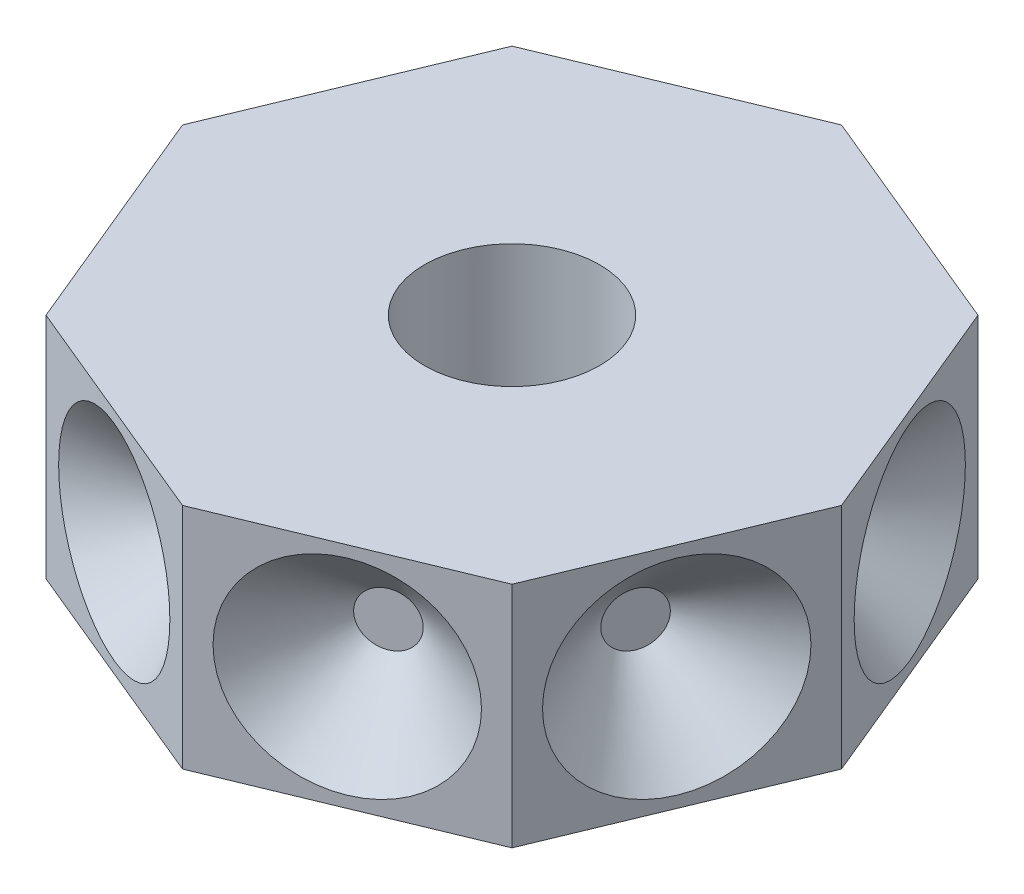
from build123d import *

# Parameters (mm, degrees)
BOSS_EXTRUDE1_DEPTH = 3
SKETCH2_R           = 1.15
CUT_EXTRUDE1_DEPTH  = 3
SKETCH3_R           = 0.15
CUT_EXTRUDE2_DEPTH  = 1
CHAMFER1_SIZE       = 1.2
CIRPATTERN3_COUNT   = 8
CHAMFER2_SIZE       = 1.2


with BuildPart() as part:
    # Sketch1 → Boss-Extrude1 (new body)
    with BuildSketch(Plane(origin=(0, 0, 0), x_dir=(1, 0, 0), z_dir=(0, 1, 0))):
        Polygon((4.329568801, 0), (3.061467459, 3.061467459), (0, 4.329568801), (-3.061467459, 3.061467459), (-4.329568801, 0), (-3.061467459, -3.061467459), (0, -4.329568801), (3.061467459, -3.061467459), align=None)
    extrude(amount=BOSS_EXTRUDE1_DEPTH)

    # Sketch2 → Cut-Extrude1 (cut)
    with BuildSketch(Plane.XZ):
        with Locations(Location((0, 0, 0), (0, 0, 270))):
            Circle(SKETCH2_R)
    extrude(amount=-CUT_EXTRUDE1_DEPTH, mode=Mode.SUBTRACT)

    # Sketch3 → Cut-Extrude2 (cut)
    with BuildSketch(Plane(origin=(-1.530733729, 0, 3.69551813), x_dir=(0.9238795325112894, 0, 0.3826834323650832), z_dir=(-0.3826834323650833, 0, 0.9238795325112895))):
        with Locations((0, 1.5)):
            Circle(SKETCH3_R)
    cut_extrude2 = extrude(amount=-CUT_EXTRUDE2_DEPTH, mode=Mode.SUBTRACT)

    # Chamfer1
    # the kernel refuses this chamfer: 1.2 mm, written as the material it takes off along each edge
    with BuildSketch(Plane(origin=(-1.530733729, 1.5, 3.69551813), x_dir=(0.9238795325112892, 0, 0.382683432365084), z_dir=(0, -1, 0))) as chamfer1_piece_1_section:
        Polygon((0.15 + CHAMFER1_SIZE, 0), (0.15, -CHAMFER1_SIZE), (0.15, 0), align=None)
    chamfer1_piece_1 = revolve(axis=Axis((-1.530733729, 1.5, 3.69551813), (-0.3826834323650833, 0, 0.9238795325112895)), mode=Mode.PRIVATE)
    chamfer1_piece_1 = split(chamfer1_piece_1, bisect_by=Plane(origin=(-1.939951072, 1.5, 2.443622557), z_dir=(-0.3826834323650833, 0, 0.9238795325112895)), keep=Keep.TOP, mode=Mode.PRIVATE)
    add(chamfer1_piece_1, mode=Mode.SUBTRACT)

    # CirPattern3: Cut-Extrude2 ×8 about axis
    cirpattern3_axis = Axis((0, 0, 0), (0, 1, 0))
    for i in range(1, CIRPATTERN3_COUNT):
        add(cut_extrude2.rotate(cirpattern3_axis, i * 360 / CIRPATTERN3_COUNT), mode=Mode.SUBTRACT)

    # Chamfer2
    # the kernel refuses this chamfer: 1.2 mm, written as the material it takes off along each edge
    with BuildSketch(Plane(origin=(1.530733729, 1.5, 3.69551813), x_dir=(0.9238795325112833, 0, -0.3826834323650982), z_dir=(0, -1, 0))) as chamfer2_piece_1_section:
        Polygon((0.15 + CHAMFER2_SIZE, 0), (0.15, -CHAMFER2_SIZE), (0.15, 0), align=None)
    chamfer2_piece_1 = revolve(axis=Axis((1.530733729, 1.5, 3.69551813), (0.3826834323650963, 0, 0.9238795325112842)), mode=Mode.PRIVATE)
    chamfer2_piece_1 = split(chamfer2_piece_1, bisect_by=Plane(origin=(0.356149522, 1.5, 3.099654638), z_dir=(0.3826834323650963, 0, 0.9238795325112842)), keep=Keep.TOP, mode=Mode.PRIVATE)
    add(chamfer2_piece_1, mode=Mode.SUBTRACT)
    with BuildSketch(Plane(origin=(3.69551813, 1.5, 1.530733729), x_dir=(0.382683432365084, 0, -0.9238795325112892), z_dir=(0, -1, 0))) as chamfer2_piece_2_section:
        Polygon((0.15 + CHAMFER2_SIZE, 0), (0.15, -CHAMFER2_SIZE), (0.15, 0), align=None)
    chamfer2_piece_2 = revolve(axis=Axis((3.69551813, 1.5, 1.530733729), (0.9238795325112895, 0, 0.3826834323650834)), mode=Mode.PRIVATE)
    chamfer2_piece_2 = split(chamfer2_piece_2, bisect_by=Plane(origin=(2.443622557, 1.5, 1.939951072), z_dir=(0.9238795325112895, 0, 0.3826834323650834)), keep=Keep.TOP, mode=Mode.PRIVATE)
    add(chamfer2_piece_2, mode=Mode.SUBTRACT)
    with BuildSketch(Plane(origin=(-3.69551813, 1.5, 1.530733729), x_dir=(0.3826834323650982, 0, 0.9238795325112833), z_dir=(0, -1, 0))) as chamfer2_piece_3_section:
        Polygon((0.15 + CHAMFER2_SIZE, 0), (0.15, -CHAMFER2_SIZE), (0.15, 0), align=None)
    chamfer2_piece_3 = revolve(axis=Axis((-3.69551813, 1.5, 1.530733729), (-0.9238795325112843, 0, 0.3826834323650961)), mode=Mode.PRIVATE)
    chamfer2_piece_3 = split(chamfer2_piece_3, bisect_by=Plane(origin=(-3.099654638, 1.5, 0.356149522), z_dir=(-0.9238795325112843, 0, 0.3826834323650961)), keep=Keep.TOP, mode=Mode.PRIVATE)
    add(chamfer2_piece_3, mode=Mode.SUBTRACT)
    with BuildSketch(Plane(origin=(-3.69551813, 1.5, -1.530733729), x_dir=(-0.382683432365084, 0, 0.9238795325112892), z_dir=(0, -1, 0))) as chamfer2_piece_4_section:
        Polygon((0.15 + CHAMFER2_SIZE, 0), (0.15, -CHAMFER2_SIZE), (0.15, 0), align=None)
    chamfer2_piece_4 = revolve(axis=Axis((-3.69551813, 1.5, -1.530733729), (-0.9238795325112894, 0, -0.3826834323650835)), mode=Mode.PRIVATE)
    chamfer2_piece_4 = split(chamfer2_piece_4, bisect_by=Plane(origin=(-2.443622557, 1.5, -1.939951072), z_dir=(-0.9238795325112894, 0, -0.3826834323650835)), keep=Keep.TOP, mode=Mode.PRIVATE)
    add(chamfer2_piece_4, mode=Mode.SUBTRACT)
    with BuildSketch(Plane(origin=(-1.530733729, 1.5, -3.69551813), x_dir=(-0.9238795325112833, 0, 0.3826834323650982), z_dir=(0, -1, 0))) as chamfer2_piece_5_section:
        Polygon((0.15 + CHAMFER2_SIZE, 0), (0.15, -CHAMFER2_SIZE), (0.15, 0), align=None)
    chamfer2_piece_5 = revolve(axis=Axis((-1.530733729, 1.5, -3.69551813), (-0.3826834323650961, 0, -0.9238795325112841)), mode=Mode.PRIVATE)
    chamfer2_piece_5 = split(chamfer2_piece_5, bisect_by=Plane(origin=(-0.356149522, 1.5, -3.099654638), z_dir=(-0.3826834323650962, 0, -0.9238795325112843)), keep=Keep.TOP, mode=Mode.PRIVATE)
    add(chamfer2_piece_5, mode=Mode.SUBTRACT)
    with BuildSketch(Plane(origin=(1.530733729, 1.5, -3.69551813), x_dir=(-0.9238795325112892, 0, -0.382683432365084), z_dir=(0, -1, 0))) as chamfer2_piece_6_section:
        Polygon((0.15 + CHAMFER2_SIZE, 0), (0.15, -CHAMFER2_SIZE), (0.15, 0), align=None)
    chamfer2_piece_6 = revolve(axis=Axis((1.530733729, 1.5, -3.69551813), (0.3826834323650834, 0, -0.9238795325112895)), mode=Mode.PRIVATE)
    chamfer2_piece_6 = split(chamfer2_piece_6, bisect_by=Plane(origin=(1.939951072, 1.5, -2.443622557), z_dir=(0.3826834323650834, 0, -0.9238795325112895)), keep=Keep.TOP, mode=Mode.PRIVATE)
    add(chamfer2_piece_6, mode=Mode.SUBTRACT)
    with BuildSketch(Plane(origin=(3.69551813, 1.5, -1.530733729), x_dir=(-0.3826834323650982, 0, -0.9238795325112833), z_dir=(0, -1, 0))) as chamfer2_piece_7_section:
        Polygon((0.15 + CHAMFER2_SIZE, 0), (0.15, -CHAMFER2_SIZE), (0.15, 0), align=None)
    chamfer2_piece_7 = revolve(axis=Axis((3.69551813, 1.5, -1.530733729), (0.9238795325112842, 0, -0.3826834323650963)), mode=Mode.PRIVATE)
    chamfer2_piece_7 = split(chamfer2_piece_7, bisect_by=Plane(origin=(3.099654638, 1.5, -0.356149522), z_dir=(0.9238795325112842, 0, -0.3826834323650963)), keep=Keep.TOP, mode=Mode.PRIVATE)
    add(chamfer2_piece_7, mode=Mode.SUBTRACT)


solid = part.part
